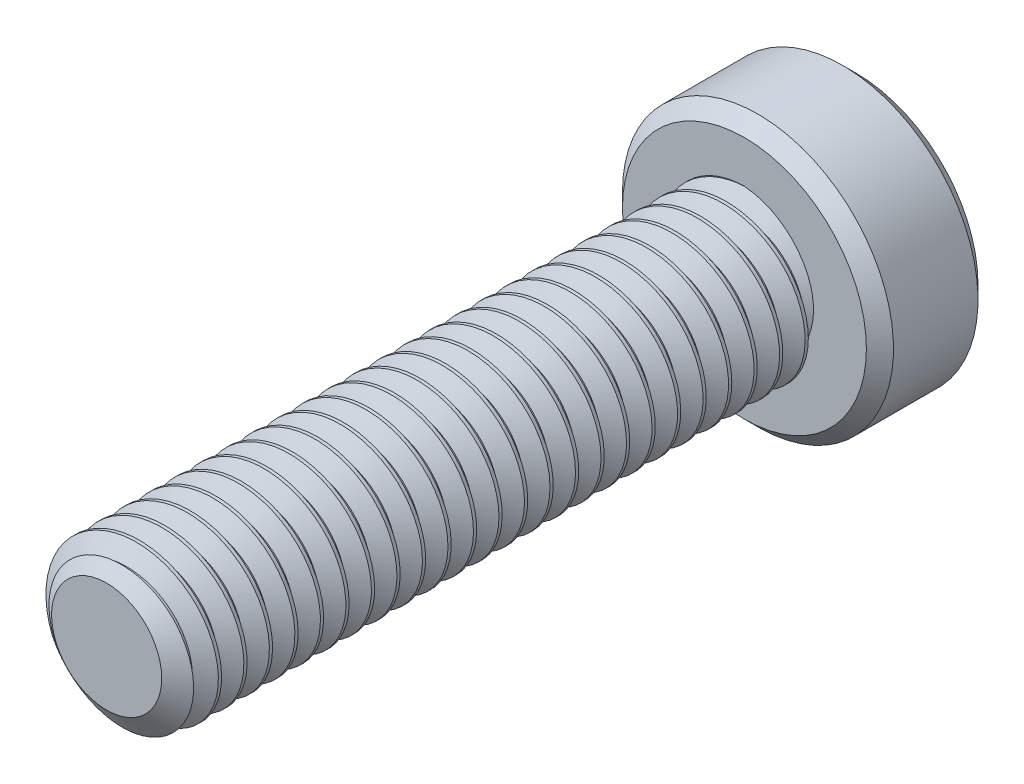
from build123d import *

# Parameters (mm, degrees)
SKETCH1_R          = 2.5
EXTRUDE1_DEPTH     = 20
CUT_SWEEP1_PITCH   = 0.8
SKETCH6_R          = 4.25
EXTRUDE2_DEPTH     = 3.5
CUT_EXTRUDE1_DEPTH = 2.25
CHAMFER1_SIZE      = 0.425


with BuildPart() as part:
    # Sketch1 → Extrude1 (new body)
    with BuildSketch(Plane.XY):
        Circle(SKETCH1_R)
    extrude(amount=-EXTRUDE1_DEPTH)

    # Cut-Sweep1: the profile of Sketch3 profile screwed along a right-hand helix of 26 turns, 6 arcs to a turn; built about Z, then put on its axis
    cut_sweep1_z = Axis((0, 0, 0), (0, 0, 1))
    cut_sweep1_corners = [(2.5003, 0, -0.700173205), (1.980384758, 0, -0.4), (1.980384758, 0, -0.3), (2.5003, 0, 0.000173205)]
    with BuildLine(mode=Mode.PRIVATE) as cut_sweep1_profile:
        Line(cut_sweep1_corners[0], cut_sweep1_corners[1])
        Line(cut_sweep1_corners[1], cut_sweep1_corners[2])
        Line(cut_sweep1_corners[2], cut_sweep1_corners[3])
        Line(cut_sweep1_corners[3], cut_sweep1_corners[0])
    cut_sweep1_cap = Face(cut_sweep1_profile.wire())
    cut_sweep1_turn_angles = [0, 30, 60, 90, 120, 150, 180, 210, 240, 270, 300, 330, 360]
    cut_sweep1_turn_weights = [1, 0.8660254037844387, 1, 0.8660254037844387, 1, 0.8660254037844387, 1, 0.8660254037844387, 1, 0.8660254037844387, 1, 0.8660254037844387, 1]
    cut_sweep1_turn_rails = [Edge.make_bspline([Vector(p[0], p[1], 0).rotate(cut_sweep1_z, cut_sweep1_turn_angles[k]) / cut_sweep1_turn_weights[k] + Vector(0, 0, p[2] + CUT_SWEEP1_PITCH * cut_sweep1_turn_angles[k] / 360) for k in range(13)], [0, 0, 0, 1, 1, 2, 2, 3, 3, 4, 4, 5, 5, 6, 6, 6], 2, cut_sweep1_turn_weights) for p in cut_sweep1_corners]
    cut_sweep1_turn_sides = [Face.make_surface_from_curves(cut_sweep1_turn_rails[p[0]], cut_sweep1_turn_rails[p[1]]) for p in [(0, 1), (1, 2), (2, 3), (3, 0)]]
    cut_sweep1 = Plane(origin=(0, 0, 0), x_dir=(0, 1, 0), z_dir=(0, 0, -1)) * Solid(Shell([*[p.moved(Location((0, 0, CUT_SWEEP1_PITCH * i))) for i in range(26) for p in cut_sweep1_turn_sides], cut_sweep1_cap, cut_sweep1_cap.rotate(cut_sweep1_z, 9360).moved(Location((0, 0, CUT_SWEEP1_PITCH * 9360 / 360)))]))
    add(cut_sweep1, mode=Mode.SUBTRACT)

    # Sketch4 → Cut-Revolve1 (revolve, cut)
    with BuildSketch(Plane(origin=(0, 0, 0), x_dir=(0, 0, -1), z_dir=(1, 0, 0)), mode=Mode.PRIVATE) as cut_revolve1_sk:
        Polygon((0.541691224, 2.5), (0, 1.726384758), (0, 2.5), align=None)
    revolve(cut_revolve1_sk.sketch.rotate(Axis((0, 0, 0), (0, 0, -1)), 260.43858876), axis=Axis((0, 0, 0), (0, 0, -1)), mode=Mode.SUBTRACT)

    # Sketch6 → Extrude2 (add)
    with BuildSketch(Plane(origin=(0, 0, -20), x_dir=(-1, 0, 0), z_dir=(0, 0, -1))):
        Circle(SKETCH6_R)
    extrude(amount=EXTRUDE2_DEPTH)

    # Sketch7 → Cut-Extrude1 (cut)
    with BuildSketch(Plane(origin=(0, 0, -23.5), x_dir=(-1, 0, 0), z_dir=(0, 0, -1))):
        Polygon((0, 1.732050808), (-1.5, 0.866025404), (-1.5, -0.866025404), (0, -1.732050808), (1.5, -0.866025404), (1.5, 0.866025404), align=None)
    extrude(amount=-CUT_EXTRUDE1_DEPTH, mode=Mode.SUBTRACT)

    # Cut-Extrude2 cone 1 section (through the dimple's axis) → Cut-Extrude2 (revolve, cut)
    with BuildSketch(Plane(origin=(0, 0, -23.5), x_dir=(0, 1, 0), z_dir=(1, 0, 0))):
        Polygon((0, 0), (1.732050808, 0), (0, 1.732050808), align=None)
    revolve(axis=Axis((0, 0, -23.5), (0, 0, 1)), mode=Mode.SUBTRACT)

    # Chamfer1
    chamfer1_edges = [part.edges().sort_by_distance(p)[0] for p in [
        (4.25, 0, -20),
        (4.25, 0, -23.5),
    ]]
    chamfer(chamfer1_edges, length=CHAMFER1_SIZE)


solid = part.part
